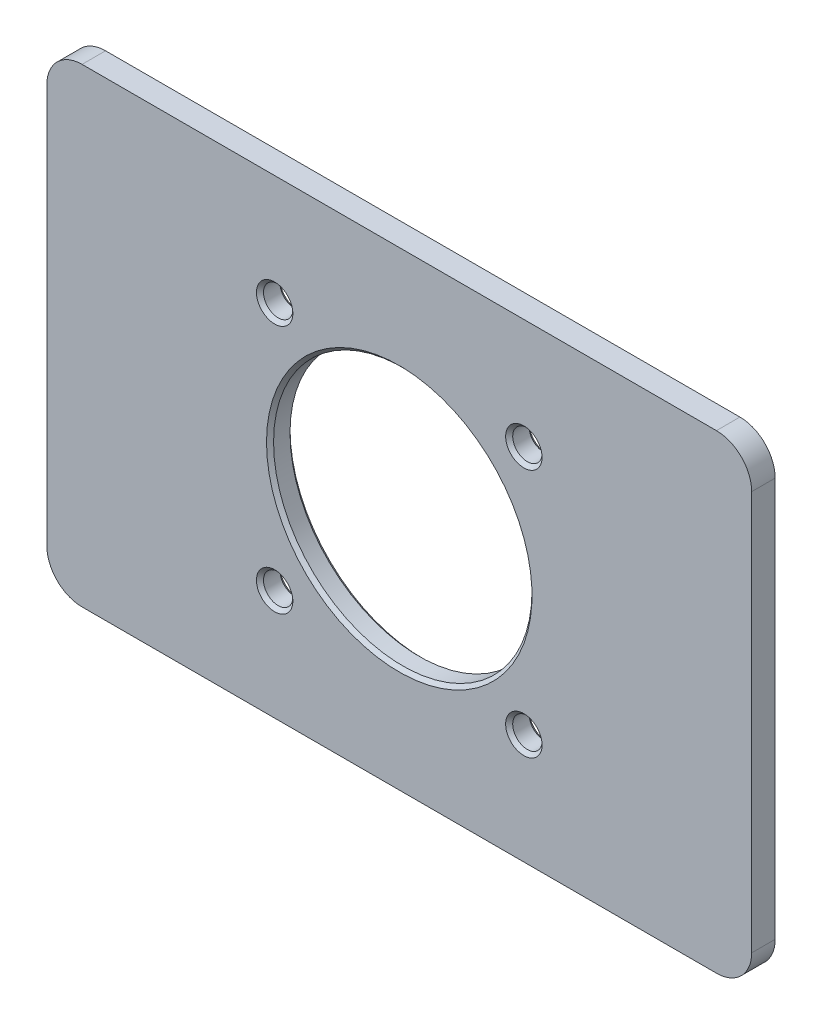
from build123d import *

# Parameters (mm, degrees)
SZKIC1_R                    = 11
SZKIC1_R_2                  = 1.25
DODANIE_WYCI_GNI_CIE1_DEPTH = 2
SFAZOWANIE1_SIZE            = 0.3


with BuildPart() as part:
    # Szkic1 → Dodanie-wyciągnięcie1 (new body)
    with BuildSketch(Plane.XY):
        with BuildLine():
            Line((-27, -20), (27, -20))
            ThreePointArc((27, -20), (29.121320344, -19.121320344), (30, -17))
            Line((30, -17), (30, 17))
            ThreePointArc((30, 17), (29.121320344, 19.121320344), (27, 20))
            Line((27, 20), (-27, 20))
            ThreePointArc((-27, 20), (-29.121320344, 19.121320344), (-30, 17))
            Line((-30, 17), (-30, -17))
            ThreePointArc((-30, -17), (-29.121320344, -19.121320344), (-27, -20))
        make_face()
        Circle(SZKIC1_R, mode=Mode.SUBTRACT)
        with Locations((-10.606601718, -10.606601718)):
            Circle(SZKIC1_R_2, mode=Mode.SUBTRACT)
        with Locations((10.606601718, -10.606601718)):
            Circle(SZKIC1_R_2, mode=Mode.SUBTRACT)
        with Locations((10.606601718, 10.606601718)):
            Circle(SZKIC1_R_2, mode=Mode.SUBTRACT)
        with Locations((-10.606601718, 10.606601718)):
            Circle(SZKIC1_R_2, mode=Mode.SUBTRACT)
    extrude(amount=DODANIE_WYCI_GNI_CIE1_DEPTH)

    # Sfazowanie1
    sfazowanie1_edges = [part.edges().sort_by_distance(p)[0] for p in [
        (9.356601718, 10.606601718, 0),
        (-11.856601718, 10.606601718, 0),
        (-11, 0, 0),
        (-11.856601718, -10.606601718, 0),
        (9.356601718, -10.606601718, 0),
        (-11.856601718, -10.606601718, 2),
        (9.356601718, -10.606601718, 2),
        (9.356601718, 10.606601718, 2),
        (-11.856601718, 10.606601718, 2),
        (-11, 0, 2),
    ]]
    chamfer(sfazowanie1_edges, length=SFAZOWANIE1_SIZE)


solid = part.part
